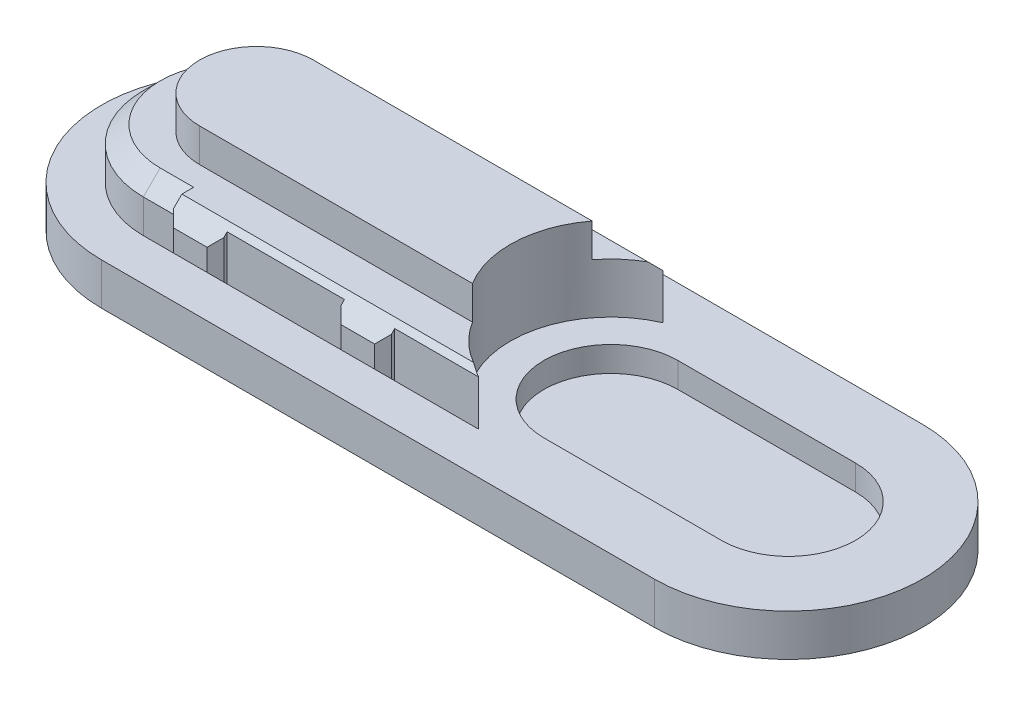
from build123d import *

# Parameters (mm, degrees)
EXTRUDE_1_DEPTH          = 3
EXTRUDE_2_DEPTH          = 2.5
CUT_EXTRUDE_1_DEPTH      = 1.5
EXTRUDE_3_DEPTH          = 2
SKETCH_5_W               = 3
SKETCH_5_H               = 0.7
EXTRUDE_4_DEPTH          = 3
CHAMFER_1_SIZE           = 1
CHAMFER_START            = -5.499796234
CHAMFER_2_DEPTH          = 7.499796234
CHAMFER_2_2_ANGLE        = 180
CHAMFER_3_SIZE           = 0.5
CUT_EXTRUDE_2_DEPTH      = 43.071367936
CUT_EXTRUDE_2_DEPTH_BACK = 43.071367936


with BuildPart() as part:
    # 草图1 → 凸台-拉伸1 (new body)
    with BuildSketch(Plane(origin=(0, 0, 0), x_dir=(1, 0, 0), z_dir=(0, 1, 0))):
        with BuildLine():
            Line((0, 5.5), (20.002084238, 5.5))
            ThreePointArc((20.002084238, 5.5), (16.4, 0), (20.002084238, -5.5))
            Line((20.002084238, -5.5), (0, -5.5))
            ThreePointArc((0, -5.5), (-5.5, 0), (0, 5.5))
        make_face()
    extrude(amount=EXTRUDE_1_DEPTH)

    # 草图2 → 凸台-拉伸2 (add)
    with BuildSketch(Plane.XZ):
        with BuildLine():
            Line((0, 8), (33, 8))
            ThreePointArc((33, 8), (41, 0), (33, -8))
            Line((33, -8), (0, -8))
            ThreePointArc((0, -8), (-8, 0), (0, 8))
        make_face()
    extrude(amount=EXTRUDE_2_DEPTH)

    # 草图3 → 切除-拉伸1 (cut)
    with BuildSketch(Plane(origin=(0, 0, 0), x_dir=(1, 0, 0), z_dir=(0, 1, 0))):
        with BuildLine():
            Line((22.4, 4), (33, 4))
            ThreePointArc((33, 4), (37, 0), (33, -4))
            Line((33, -4), (22.4, -4))
            ThreePointArc((22.4, -4), (18.4, 0), (22.4, 4))
        make_face()
    extrude(amount=-CUT_EXTRUDE_1_DEPTH, mode=Mode.SUBTRACT)

    # 草图4 → 凸台-拉伸3 (add)
    with BuildSketch(Plane(origin=(0, 3, 0), x_dir=(1, 0, 0), z_dir=(0, 1, 0))):
        with BuildLine():
            Line((1, 3.65), (17.637910123, 3.65))
            ThreePointArc((17.637910123, 3.65), (16.407686099, 0.30360189), (17.293386641, -3.15))
            Line((17.293386641, -3.15), (1, -3.15))
            ThreePointArc((1, -3.15), (-2.4, 0.25), (1, 3.65))
        make_face()
    extrude(amount=EXTRUDE_3_DEPTH)

    # 草图5 → 凸台-拉伸4 (add)
    with BuildSketch(Plane(origin=(0, 0, 0), x_dir=(1, 0, 0), z_dir=(0, 1, 0))):
        with Locations((3.5, 5.85)):
            Rectangle(SKETCH_5_W, SKETCH_5_H)
        with Locations((13.5, 5.85)):
            Rectangle(SKETCH_5_W, SKETCH_5_H)
        with Locations((13.5, -5.85)):
            Rectangle(SKETCH_5_W, SKETCH_5_H)
        with Locations((3.5, -5.85)):
            Rectangle(SKETCH_5_W, SKETCH_5_H)
    extrude(amount=EXTRUDE_4_DEPTH)

    # 倒角1
    chamfer_1_edges = [part.edges().sort_by_distance(p)[0] for p in [
        (3.5, 3, -6.2),
        (3.5, 3, 6.2),
    ]]
    chamfer(chamfer_1_edges, length=CHAMFER_1_SIZE)

    # 倒角2: read off the stored shape, not the designer's step
    # 倒角2 outline → 倒角2 (cut)
    with BuildSketch(Plane.YZ.offset(CHAMFER_START)):
        Polygon((3, -5.2), (3, -4.5), (2, -5.5), (2.7, -5.5), align=None)
        Polygon((2, 5.5), (3, 4.5), (3, 5.2), (2.7, 5.5), align=None)
    extrude(amount=CHAMFER_2_DEPTH, mode=Mode.SUBTRACT)

    # Chamfer 2 2 outline → Chamfer 2 2 (revolve, cut)
    with BuildSketch(Plane(origin=(0, 0, 0), x_dir=(0, 0, -1), z_dir=(1, 0, 0))):
        Polygon((5.5, 3), (4.5, 3), (5.5, 2), align=None)
    revolve(axis=Axis((0, 0, 0), (0, 1, 0)), revolution_arc=CHAMFER_2_2_ANGLE, mode=Mode.SUBTRACT)

    # 倒角3
    chamfer_3_edges = [part.edges().sort_by_distance(p)[0] for p in [
        (2, 1, -6.2),
        (5, 1, -6.2),
        (12, 1, -6.2),
        (15, 1, -6.2),
        (15, 1, 6.2),
        (12, 1, 6.2),
        (5, 1, 6.2),
        (2, 1, 6.2),
    ]]
    chamfer(chamfer_3_edges, length=CHAMFER_3_SIZE)

    # 草图6 → 切除-拉伸2 (cut, two sides: drawn at the far end of the back side and taken through both)
    with BuildSketch(Plane(origin=(0, 0, 0), x_dir=(0, 0, -1), z_dir=(1, 0, 0)).offset(-CUT_EXTRUDE_2_DEPTH_BACK)):
        Polygon((-5.5, 0), (-6.2, 0.7), (-6.2, 0), align=None)
        Polygon((5.5, 0), (6.2, 0), (6.2, 0.7), align=None)
    extrude(amount=CUT_EXTRUDE_2_DEPTH + CUT_EXTRUDE_2_DEPTH_BACK, mode=Mode.SUBTRACT)


solid = part.part
